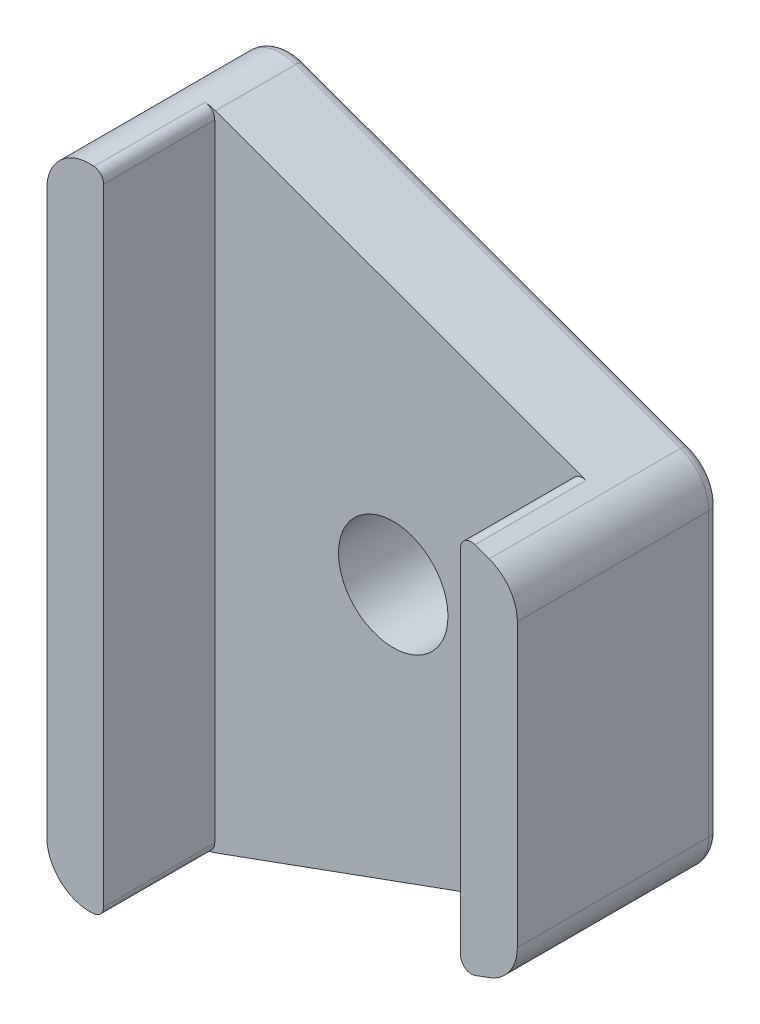
from build123d import *

# Parameters (mm, degrees)
SKETCH1_R           = 2.032
BOSS_EXTRUDE1_DEPTH = 3.375
BOSS_EXTRUDE2_DEPTH = 4.125
FILLET1_R           = 1.5875
FILLET2_R           = 0.396875


with BuildPart() as part:
    # Sketch1 → Boss-Extrude1 (new body)
    with BuildSketch(Plane.XY):
        Polygon((5.820833333333332, -6.35), (-11.641666666666666, -12.7), (-11.641666666666666, 12.7), (5.820833333333332, 6.35), align=None)
        with Locations((-2.910416666666667, 0)):
            Circle(SKETCH1_R, mode=Mode.SUBTRACT)
    extrude(amount=BOSS_EXTRUDE1_DEPTH)

    # Sketch2 → Boss-Extrude2 (add)
    with BuildSketch(Plane.XY.offset(3.375)):
        Polygon((-11.641666666666666, 12.7), (-11.641666666666666, -12.7), (-9.535416666666665, -11.934090909090909), (-9.535416666666668, 11.934090909090909), align=None)
        Polygon((5.820833333333332, 6.35), (5.820833333333332, -6.35), (3.714583333333334, -7.1159090909090885), (3.7145833333333322, 7.115909090909089), align=None)
    extrude(amount=BOSS_EXTRUDE2_DEPTH)

    # Fillet1
    fillet1_edges = [part.edges().sort_by_distance(p)[0] for p in [
        (5.820833333333332, -6.35, 3.75),
        (-11.641666666666666, -12.7, 3.75),
        (-11.641666666666666, 12.7, 3.75),
        (5.820833333333332, 6.35, 3.75),
    ]]
    fillet(fillet1_edges, radius=FILLET1_R)

    # Fillet2
    fillet2_edges = [part.edges().sort_by_distance(p)[0] for p in [
        (3.714583333333334, -7.1159090909090885, 5.4375),
        (-9.535416666666665, -11.933877784195701, 5.4375),
        (3.7145833333333322, 7.115909090909089, 5.4375),
        (-9.535416666666668, 11.933877784195703, 5.4375),
        (5.533602952745419, 6.148816010211666, 0),
        (5.820833333333332, 0, 0),
        (5.533602952745419, -6.148816010211666, 0),
        (-2.3678995540165237, -9.327721049945401, 0),
        (-10.964910959448096, -11.733795882296866, 0),
        (-11.641666666666666, 0, 0),
        (-10.964910959448096, 11.733795882296866, 0),
        (-2.367899554016523, 9.327721049945401, 0),
    ]]
    fillet(fillet2_edges, radius=FILLET2_R)


solid = part.part
